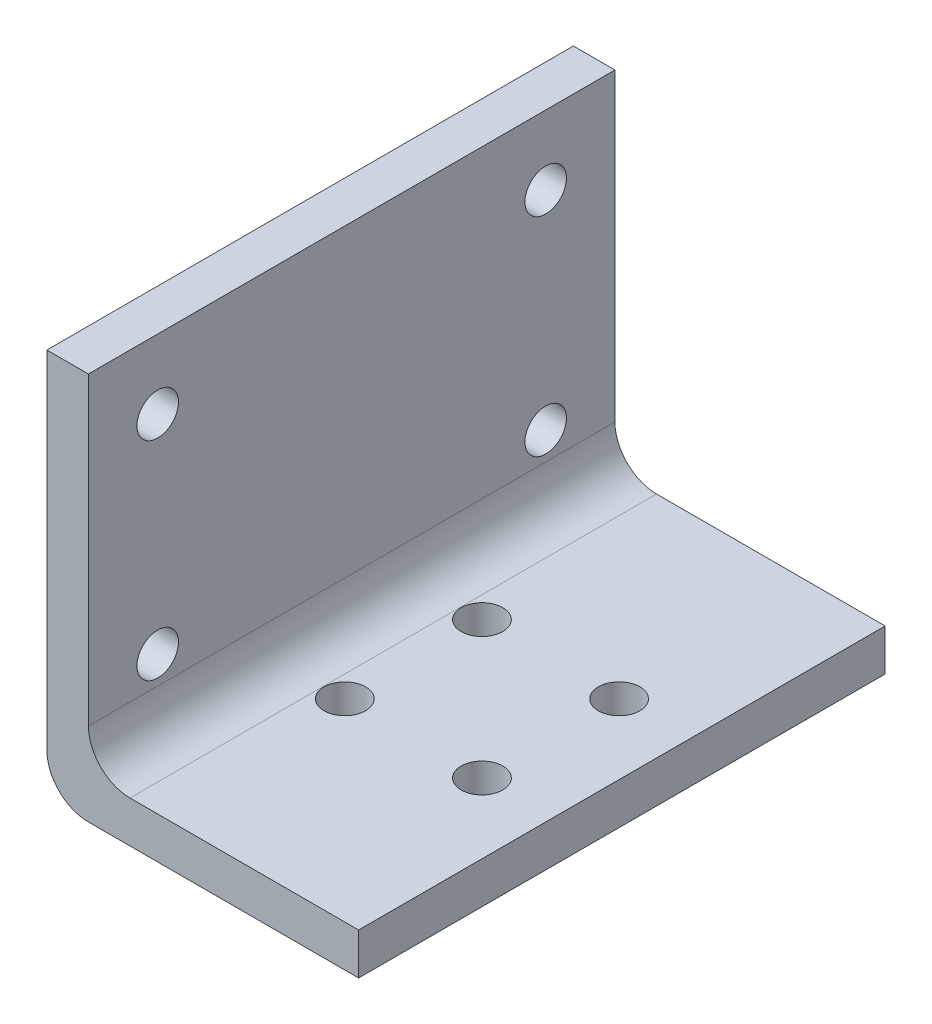
from build123d import *

# Parameters (mm, degrees)
SKETCH_1_W          = 22.5
SKETCH_1_H          = 38
EXTRUDE_1_DEPTH     = 3
SKETCH_2_W          = 3
SKETCH_2_H          = 38
EXTRUDE_2_DEPTH     = 25
SKETCH_3_R          = 1.5
CUT_EXTRUDE_2_DEPTH = 25
SKETCH_4_R          = 1.5
CUT_EXTRUDE_3_DEPTH = 25
FILLET_1_R          = 3
FILLET_2_R          = 3


with BuildPart() as part:
    # 草图1 → 凸台-拉伸1 (new body)
    with BuildSketch(Plane(origin=(0, 0, 0), x_dir=(1, 0, 0), z_dir=(0, 1, 0))):
        Rectangle(SKETCH_1_W, SKETCH_1_H)
    extrude(amount=EXTRUDE_1_DEPTH)

    # 草图2 → 凸台-拉伸2 (add)
    with BuildSketch(Plane(origin=(0, 3, 0), x_dir=(1, 0, 0), z_dir=(0, 1, 0))):
        with Locations((-9.75, 0)):
            Rectangle(SKETCH_2_W, SKETCH_2_H)
    extrude(amount=EXTRUDE_2_DEPTH)

    # 草图3 → 切除-拉伸2 (cut)
    with BuildSketch(Plane.XZ):
        with Locations((-3.699747468, 5.049747468)):
            Circle(SKETCH_3_R)
        with Locations((6.199747468, 5.049747468)):
            Circle(SKETCH_3_R)
        with Locations((-3.699747468, -4.849747468)):
            Circle(SKETCH_3_R)
        with Locations((6.199747468, -4.849747468)):
            Circle(SKETCH_3_R)
    extrude(amount=-CUT_EXTRUDE_2_DEPTH, mode=Mode.SUBTRACT)

    # 草图4 → 切除-拉伸3 (cut)
    with BuildSketch(Plane(origin=(-8.25, 0, 0), x_dir=(0, 0, -1), z_dir=(1, 0, 0))):
        with Locations((14, 23)):
            Circle(SKETCH_4_R)
        with Locations((-14, 23)):
            Circle(SKETCH_4_R)
        with Locations((-14, 8)):
            Circle(SKETCH_4_R)
        with Locations((14, 8)):
            Circle(SKETCH_4_R)
    extrude(amount=-CUT_EXTRUDE_3_DEPTH, mode=Mode.SUBTRACT)

    # 圆角1
    fillet_1_edges = [part.edges().sort_by_distance(p)[0] for p in [
        (-8.25, 3, 0),
    ]]
    fillet(fillet_1_edges, radius=FILLET_1_R)

    # 圆角2
    fillet_2_edges = [part.edges().sort_by_distance(p)[0] for p in [
        (-11.25, 0, 0),
    ]]
    fillet(fillet_2_edges, radius=FILLET_2_R)


solid = part.part
